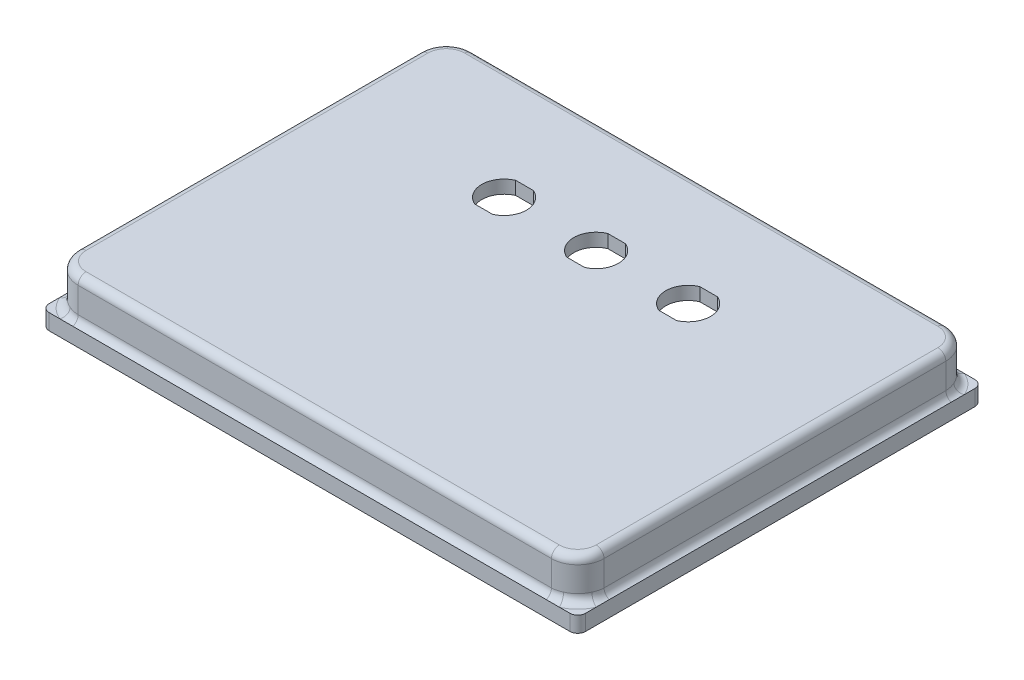
from build123d import *

# Parameters (mm, degrees)
SKETCH1_W           = 200
SKETCH1_H           = 150
SKETCH1_R           = 3
BOSS_EXTRUDE1_DEPTH = 15.5
SKETCH2_W           = 200
SKETCH2_H           = 150
BOSS_EXTRUDE2_DEPTH = 5
SKETCH3_W           = 204
SKETCH3_H           = 154
SKETCH3_W_2         = 189.5
SKETCH3_H_2         = 139.5
BOSS_EXTRUDE3_DEPTH = 5
SKETCH4_W           = 204
SKETCH4_H           = 154
SKETCH4_W_2         = 200
SKETCH4_H_2         = 150
BOSS_EXTRUDE4_DEPTH = 1
FILLET1_R           = 10
FILLET2_R           = 3
CUT_EXTRUDE1_DEPTH  = 10


with BuildPart() as part:
    # Sketch1 → Boss-Extrude1 (new body)
    with BuildSketch(Plane(origin=(0, 0, 0), x_dir=(1, 0, 0), z_dir=(0, 1, 0))):
        with Locations((100, 75)):
            Rectangle(SKETCH1_W, SKETCH1_H)
        with BuildLine():
            Line((9.846194078, 18.9), (5.25, 18.9))
            Line((5.25, 18.9), (5.25, 131.1))
            Line((5.25, 131.1), (9.846194078, 131.1))
            ThreePointArc((9.846194078, 131.1), (16.248201641, 133.751798359), (18.9, 140.153805922))
            Line((18.9, 140.153805922), (18.9, 144.75))
            Line((18.9, 144.75), (181.1, 144.75))
            Line((181.1, 144.75), (181.1, 140.153805922))
            ThreePointArc((181.1, 140.153805922), (183.751798359, 133.751798359), (190.153805922, 131.1))
            Line((190.153805922, 131.1), (194.75, 131.1))
            Line((194.75, 131.1), (194.75, 18.9))
            Line((194.75, 18.9), (190.153805922, 18.9))
            ThreePointArc((190.153805922, 18.9), (183.751798359, 16.248201641), (181.1, 9.846194078))
            Line((181.1, 9.846194078), (181.1, 5.25))
            Line((181.1, 5.25), (18.9, 5.25))
            Line((18.9, 5.25), (18.9, 9.846194078))
            ThreePointArc((18.9, 9.846194078), (16.248201641, 16.248201641), (9.846194078, 18.9))
        make_face(mode=Mode.SUBTRACT)
        with Locations((9.846194078, 9.846194078)):
            Circle(SKETCH1_R, mode=Mode.SUBTRACT)
        with Locations((190.153805922, 9.846194078)):
            Circle(SKETCH1_R, mode=Mode.SUBTRACT)
        with Locations((190.153805922, 140.153805922)):
            Circle(SKETCH1_R, mode=Mode.SUBTRACT)
        with Locations((9.846194078, 140.153805922)):
            Circle(SKETCH1_R, mode=Mode.SUBTRACT)
    extrude(amount=BOSS_EXTRUDE1_DEPTH)

    # Sketch2 → Boss-Extrude2 (add)
    with BuildSketch(Plane(origin=(0, 15.5, 0), x_dir=(1, 0, 0), z_dir=(0, 1, 0))):
        with Locations((100, 75)):
            Rectangle(SKETCH2_W, SKETCH2_H)
    extrude(amount=BOSS_EXTRUDE2_DEPTH)

    # Sketch3 → Boss-Extrude3 (add)
    with BuildSketch(Plane.XZ):
        with Locations((100, -75)):
            Rectangle(SKETCH3_W, SKETCH3_H)
        with Locations((100, -75)):
            Rectangle(SKETCH3_W_2, SKETCH3_H_2, mode=Mode.SUBTRACT)
    extrude(amount=-BOSS_EXTRUDE3_DEPTH)

    # Sketch4 → Boss-Extrude4 (add)
    with BuildSketch(Plane.XZ):
        with Locations((100, -75)):
            Rectangle(SKETCH4_W, SKETCH4_H)
        with Locations((100, -75)):
            Rectangle(SKETCH4_W_2, SKETCH4_H_2, mode=Mode.SUBTRACT)
    extrude(amount=BOSS_EXTRUDE4_DEPTH)

    # Fillet1
    fillet1_edges = [part.edges().sort_by_distance(p)[0] for p in [
        (200, 12.75, -150),
        (200, 12.75, 0),
        (0, 12.75, -150),
        (0, 12.75, 0),
    ]]
    fillet(fillet1_edges, radius=FILLET1_R)

    # Fillet2
    fillet2_edges = [part.edges().sort_by_distance(p)[0] for p in [
        (197.071067812, 5, -2.928932188),
        (197.071067812, 5, -147.071067812),
        (2.928932188, 5, -147.071067812),
        (2.928932188, 5, -2.928932188),
        (0, 5, -75),
        (100, 5, 0),
        (100, 5, -150),
        (200, 5, -75),
    ]]
    fillet(fillet2_edges, radius=FILLET2_R)
    fillet2_2_edges = [part.edges().sort_by_distance(p)[0] for p in [
        (197.071067812, 20.5, -2.928932188),
        (100, 20.5, 0),
        (2.928932188, 20.5, -2.928932188),
        (0, 20.5, -75),
        (2.928932188, 20.5, -147.071067812),
        (100, 20.5, -150),
        (197.071067812, 20.5, -147.071067812),
        (200, 20.5, -75),
        (-2, 2, 2),
        (202, 2, 2),
        (202, 2, -152),
    ]]
    fillet(fillet2_2_edges, radius=FILLET2_R)

    # Sketch6 → Cut-Extrude1 (cut)
    with BuildSketch(Plane(origin=(0, 20.5, 0), x_dir=(1, 0, 0), z_dir=(0, 1, 0))):
        with BuildLine():
            Line((103.377869151, 114.8), (96.622130849, 114.8))
            ThreePointArc((96.622130849, 114.8), (91.5, 107), (96.622130849, 99.2))
            Line((96.622130849, 99.2), (103.377869151, 99.2))
            ThreePointArc((103.377869151, 99.2), (108.5, 107), (103.377869151, 114.8))
        make_face()
        with BuildLine():
            Line((138.377869151, 114.8), (131.622130849, 114.8))
            ThreePointArc((131.622130849, 114.8), (126.5, 107), (131.622130849, 99.2))
            Line((131.622130849, 99.2), (138.377869151, 99.2))
            ThreePointArc((138.377869151, 99.2), (143.5, 107), (138.377869151, 114.8))
        make_face()
        with BuildLine():
            Line((61.622130849, 99.2), (68.377869151, 99.2))
            ThreePointArc((68.377869151, 99.2), (73.5, 107), (68.377869151, 114.8))
            Line((68.377869151, 114.8), (61.622130849, 114.8))
            ThreePointArc((61.622130849, 114.8), (56.5, 107), (61.622130849, 99.2))
        make_face()
    extrude(amount=-CUT_EXTRUDE1_DEPTH, mode=Mode.SUBTRACT)


solid = part.part
